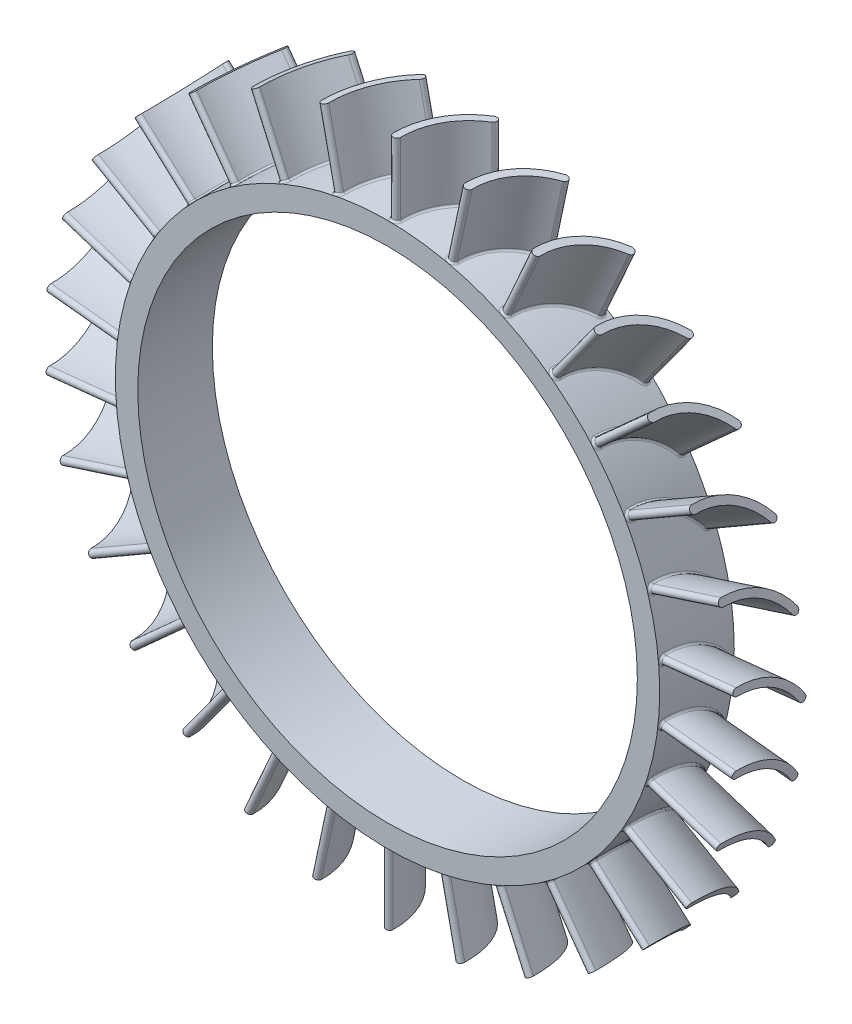
from build123d import *

# Parameters (mm, degrees)
SKETCH1_R                = 73
SKETCH1_R_2              = 67
BOSS_EXTRUDE1_DEPTH      = 10
BOSS_EXTRUDE2_START      = 68
BOSS_EXTRUDE2_DEPTH      = 24.5
FILLET1_R                = 0.5
CIRPATTERN1_COUNT        = 30
FILLET1_OF_CIRPATTERN1_R = 0.5


with BuildPart() as part:
    # Sketch1 → Boss-Extrude1 (new, symmetric)
    with BuildSketch(Plane.XY):
        Circle(SKETCH1_R)
        Circle(SKETCH1_R_2, mode=Mode.SUBTRACT)
    extrude(amount=BOSS_EXTRUDE1_DEPTH, both=True)

    # Sketch2 → Boss-Extrude2 (add)
    with BuildSketch(Plane(origin=(0, 0, 0), x_dir=(1, 0, 0), z_dir=(0, 1, 0)).offset(BOSS_EXTRUDE2_START)):
        with BuildLine():
            ThreePointArc((-0.015411203, -8.5), (2.48026862, 1.546814045), (9.664759511, 9))
            ThreePointArc((9.664759511, 9), (11.037278052, 8.659129273), (10.696407325, 7.286610731))
            ThreePointArc((10.696407325, 7.286610731), (4.230365523, 0.578743372), (1.984253683, -8.463389269))
            ThreePointArc((1.984253683, -8.463389269), (1.002726606, -9.481527077), (-0.015411203, -8.5))
        make_face()
    boss_extrude2 = extrude(amount=BOSS_EXTRUDE2_DEPTH)

    # Fillet1
    fillet1_edges = [part.edges().sort_by_distance(p)[0] for p in [
        (2.485414926, 72.957677557, -1.556111808),
        (2.485414926, 72.957677557, -1.556111808),
        (4.2367874, 72.876948583, -0.59034287),
        (1.002786497, 72.993112136, 9.481525977),
    ]]
    fillet(fillet1_edges, radius=FILLET1_R)

    # CirPattern1: Boss-Extrude2 ×30 about axis
    cirpattern1_axis = Axis((0, 0, 10), (0, 0, -1))
    for i in range(1, CIRPATTERN1_COUNT):
        add(boss_extrude2.rotate(cirpattern1_axis, i * 360 / CIRPATTERN1_COUNT))

    # Fillet1 of CirPattern1
    fillet1_of_cirpattern1_edges = [part.edges().sort_by_distance(p)[0] for p in [
        (17.599856746, 70.846630438, -1.556111808),
        (17.599856746, 70.846630438, -1.556111808),
        (19.296173031, 70.403534774, -0.59034287),
        (16.156994568, 71.18954647, 9.481525977),
        (31.945100372, 65.639245609, -1.556111808),
        (31.945100372, 65.639245609, -1.556111808),
        (33.512223308, 64.853148661, -0.59034287),
        (30.605064447, 66.274656017, 9.481525977),
        (44.894189823, 57.563110774, -1.556111808),
        (44.894189823, 57.563110774, -1.556111808),
        (46.263628617, 56.468368751, -0.59034287),
        (43.71554615, 58.463245076, 9.481525977),
        (55.881187752, 46.971191781, -1.556111808),
        (55.881187752, 46.971191781, -1.556111808),
        (56.993091358, 45.615650162, -0.59034287),
        (54.915448716, 48.096709787, 9.481525977),
        (64.425909628, 34.326406314, -1.556111808),
        (64.425909628, 34.326406314, -1.556111808),
        (65.231682523, 32.769308773, -0.59034287),
        (63.71528266, 35.628117487, 9.481525977),
        (70.154910104, 20.181392174, -1.556111808),
        (70.154910104, 20.181392174, -1.556111808),
        (70.619336146, 18.490791346, -0.59034287),
        (69.730453011, 21.60240549, 9.481525977),
        (72.817804368, 5.154354356, -1.556111808),
        (72.817804368, 5.154354356, -1.556111808),
        (72.92058591, 3.404137608, -0.59034287),
        (72.698067962, 6.632564713, 9.481525977),
        (72.298211163, -10.097953481, -1.556111808),
        (72.298211163, -10.097953481, -1.556111808),
        (72.034856158, -11.831293278, -0.59034287),
        (72.488428499, -8.627150968, 9.481525977),
        (68.618839204, -24.908932296, -1.556111808),
        (68.618839204, -24.908932296, -1.556111808),
        (68.00085753, -26.549639875, -0.59034287),
        (69.110696872, -23.509818755, 9.481525977),
        (61.940494702, -38.631271243, -1.556111808),
        (61.940494702, -38.631271243, -1.556111808),
        (60.994895124, -40.10763981, -0.59034287),
        (62.712496163, -37.364994649, 9.481525977),
        (52.555053359, -50.665238264, -1.556111808),
        (52.555053359, -50.665238264, -1.556111808),
        (51.323163115, -51.912743428, -0.59034287),
        (53.573458443, -49.58714098, 9.481525977),
        (40.872703996, -60.484891253, -1.556111808),
        (40.872703996, -60.484891253, -1.556111808),
        (39.408362602, -61.449011053, -0.59034287),
        (42.093003515, -59.642091305, 9.481525977),
        (27.40402134, -67.661064256, -1.556111808),
        (27.40402134, -67.661064256, -1.556111808),
        (25.771227541, -68.299662029, -0.59034287),
        (28.772882348, -67.090396045, 9.481525977),
        (12.737651452, -71.880124077, -1.556111808),
        (12.737651452, -71.880124077, -1.556111808),
        (11.007766172, -72.165290037, -0.59034287),
        (14.195248156, -71.606528542, 9.481525977),
        (-2.485414926, -72.957677557, -1.556111808),
        (-2.485414926, -72.957677557, -1.556111808),
        (-4.2367874, -72.876948583, -0.59034287),
        (-1.002786497, -72.993112136, 9.481525977),
        (-17.599856746, -70.846630438, -1.556111808),
        (-17.599856746, -70.846630438, -1.556111808),
        (-19.296173031, -70.403534774, -0.59034287),
        (-16.156994568, -71.18954647, 9.481525977),
        (-31.945100372, -65.639245609, -1.556111808),
        (-31.945100372, -65.639245609, -1.556111808),
        (-33.512223308, -64.853148661, -0.59034287),
        (-30.605064447, -66.274656017, 9.481525977),
        (-44.894189823, -57.563110774, -1.556111808),
        (-44.894189823, -57.563110774, -1.556111808),
        (-46.263628617, -56.468368751, -0.59034287),
        (-43.71554615, -58.463245076, 9.481525977),
        (-55.881187752, -46.971191781, -1.556111808),
        (-55.881187752, -46.971191781, -1.556111808),
        (-56.993091358, -45.615650162, -0.59034287),
        (-54.915448716, -48.096709787, 9.481525977),
        (-64.425909628, -34.326406314, -1.556111808),
        (-64.425909628, -34.326406314, -1.556111808),
        (-65.231682523, -32.769308773, -0.59034287),
        (-63.71528266, -35.628117487, 9.481525977),
        (-70.154910104, -20.181392174, -1.556111808),
        (-70.154910104, -20.181392174, -1.556111808),
        (-70.619336146, -18.490791346, -0.59034287),
        (-69.730453011, -21.60240549, 9.481525977),
        (-72.817804368, -5.154354356, -1.556111808),
        (-72.817804368, -5.154354356, -1.556111808),
        (-72.92058591, -3.404137608, -0.59034287),
        (-72.698067962, -6.632564713, 9.481525977),
        (-72.298211163, 10.097953481, -1.556111808),
        (-72.298211163, 10.097953481, -1.556111808),
        (-72.034856158, 11.831293278, -0.59034287),
        (-72.488428499, 8.627150968, 9.481525977),
        (-68.618839204, 24.908932296, -1.556111808),
        (-68.618839204, 24.908932296, -1.556111808),
        (-68.00085753, 26.549639875, -0.59034287),
        (-69.110696872, 23.509818755, 9.481525977),
        (-61.940494702, 38.631271243, -1.556111808),
        (-61.940494702, 38.631271243, -1.556111808),
        (-60.994895124, 40.10763981, -0.59034287),
        (-62.712496163, 37.364994649, 9.481525977),
        (-52.555053359, 50.665238264, -1.556111808),
        (-52.555053359, 50.665238264, -1.556111808),
        (-51.323163115, 51.912743428, -0.59034287),
        (-53.573458443, 49.58714098, 9.481525977),
        (-40.872703996, 60.484891253, -1.556111808),
        (-40.872703996, 60.484891253, -1.556111808),
        (-39.408362602, 61.449011053, -0.59034287),
        (-42.093003515, 59.642091305, 9.481525977),
        (-27.40402134, 67.661064256, -1.556111808),
        (-27.40402134, 67.661064256, -1.556111808),
        (-25.771227541, 68.299662029, -0.59034287),
        (-28.772882348, 67.090396045, 9.481525977),
        (-12.737651452, 71.880124077, -1.556111808),
        (-12.737651452, 71.880124077, -1.556111808),
        (-11.007766172, 72.165290037, -0.59034287),
        (-14.195248156, 71.606528542, 9.481525977),
    ]]
    fillet(fillet1_of_cirpattern1_edges, radius=FILLET1_OF_CIRPATTERN1_R)


solid = part.part
